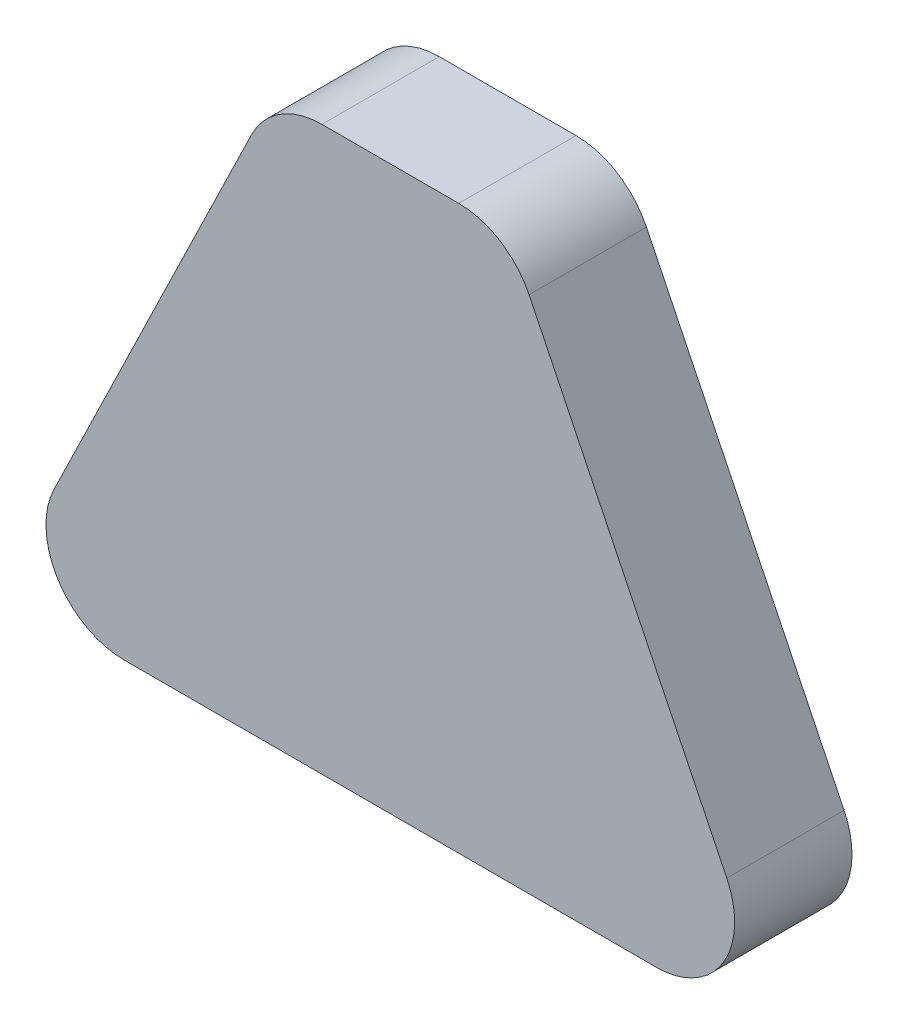
from build123d import *

# Parameters (mm, degrees)
BOSS_EXTRUDE1_DEPTH = 15
FILLET1_R           = 10


with BuildPart() as part:
    # Sketch1 → Boss-Extrude1 (new body)
    with BuildSketch(Plane.XY):
        Polygon((0, 0), (35, 71.93747285), (65, 71.93747285), (100, 0), align=None)
    extrude(amount=BOSS_EXTRUDE1_DEPTH)

    # Fillet1
    fillet1_edges = [part.edges().sort_by_distance(p)[0] for p in [
        (0, 0, 7.5),
        (100, 0, 7.5),
        (65, 71.93747285, 7.5),
        (35, 71.93747285, 7.5),
    ]]
    fillet(fillet1_edges, radius=FILLET1_R)


solid = part.part
